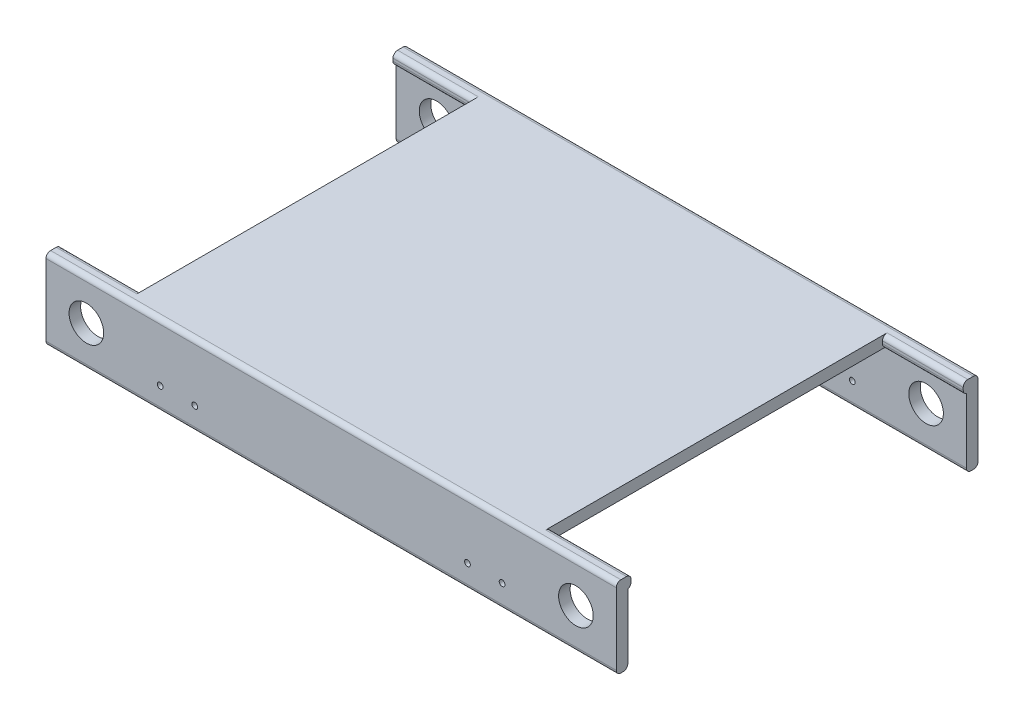
from build123d import *

# Parameters (mm, degrees)
BOSS_EXTRUDE1_DEPTH = 3.175
SKETCH2_W           = 156.972
SKETCH2_H           = 22.225
SKETCH2_R           = 4.7625
SKETCH2_R_2         = 0.79375
BOSS_EXTRUDE2_DEPTH = 3.175
FILLET2_R           = 1.27


with BuildPart() as part:
    # Sketch1 → Boss-Extrude1 (new body)
    with BuildSketch(Plane(origin=(0, 0, 0), x_dir=(1, 0, 0), z_dir=(0, 1, 0))):
        Polygon((-78.486, 49.784), (-78.486, 45.72), (-56.261, 45.72), (-56.261, -45.72), (-78.486, -45.72), (-78.486, -49.784), (78.486, -49.784), (78.486, -45.72), (56.261, -45.72), (56.261, 45.72), (78.486, 45.72), (78.486, 49.784), align=None)
    extrude(amount=BOSS_EXTRUDE1_DEPTH)

    # Sketch2 → Boss-Extrude2 (add)
    with BuildSketch(Plane.XY.offset(49.784)):
        with Locations((0, -7.9375)):
            Rectangle(SKETCH2_W, SKETCH2_H)
        with Locations((-67.3735, -7.9375)):
            Circle(SKETCH2_R, mode=Mode.SUBTRACT)
        with Locations(Location((67.3735, -7.9375, 0), (0, 0, 180))):
            Circle(SKETCH2_R, mode=Mode.SUBTRACT)
        with Locations((-47.0535, -12.7)):
            Circle(SKETCH2_R_2, mode=Mode.SUBTRACT)
        with Locations((-37.5285, -12.7)):
            Circle(SKETCH2_R_2, mode=Mode.SUBTRACT)
        with Locations(Location((37.5285, -12.7, 0), (0, 0, 180))):
            Circle(SKETCH2_R_2, mode=Mode.SUBTRACT)
        with Locations(Location((47.0535, -12.7, 0), (0, 0, 180))):
            Circle(SKETCH2_R_2, mode=Mode.SUBTRACT)
    boss_extrude2 = extrude(amount=-BOSS_EXTRUDE2_DEPTH)

    # Mirror2: Boss-Extrude2 across plane
    add(boss_extrude2.mirror(Plane.XY))

    # Fillet2
    # the kernel refuses this fillet: 1.27 mm, written as the material it takes off along each edge
    with BuildSketch(Plane(origin=(-56.261, 0, 45.72), x_dir=(0, 1, 0), z_dir=(-1, 0, 0)), Plane(origin=(56.261, 0, -45.72), x_dir=(0, 1, 0), z_dir=(1, 0, 0)), Plane(origin=(81.514756964, 0, 45.72), x_dir=(0, 1, 0), z_dir=(-1, 0, 0))) as fillet2_piece_1:
        with BuildLine():
            CenterArc((1.211502786, -1.27), FILLET2_R, 90, 72.542396876)
            Line((0, -0.889), (-0.024230056, -0.88138))
            ThreePointArc((-0.024230056, -0.88138), (-0.0254, -0.4445), (-0.0254, 0))
            Line((-0.0254, 0), (0, 0.0254))
            Line((0, 0.0254), (1.211502786, 0.0254))
            Line((1.211502786, 0.0254), (1.211502786, 0))
        make_face()
    extrude(amount=25.253756964, mode=Mode.SUBTRACT)
    with BuildSketch(Plane(origin=(-81.514756964, 0, -45.72), x_dir=(0, 0, -1), z_dir=(1, 0, 0))) as fillet2_piece_2:
        with BuildLine():
            CenterArc((1.27, 1.211502786), FILLET2_R, 180, 72.542396876)
            Line((0, 1.211502786), (-0.0254, 1.211502786))
            Line((-0.0254, 1.211502786), (-0.0254, 0))
            Line((-0.0254, 0), (0, -0.0254))
            ThreePointArc((0, -0.0254), (0.4445, -0.0254), (0.88138, -0.024230056))
            Line((0.88138, -0.024230056), (0.889, 0))
        make_face()
    extrude(amount=25.253756964, mode=Mode.SUBTRACT)
    with BuildSketch(Plane(origin=(81.661, 3.175, 45.72), x_dir=(0, -1, 0), z_dir=(-1, 0, 0)), Plane(origin=(56.261, 3.175, -45.72), x_dir=(0, -1, 0), z_dir=(1, 0, 0)), Plane(origin=(-81.661, 3.175, -45.72), x_dir=(0, -1, 0), z_dir=(1, 0, 0)), Plane(origin=(-56.261, 3.175, 45.72), x_dir=(0, -1, 0), z_dir=(-1, 0, 0))) as fillet2_piece_3:
        with BuildLine():
            CenterArc((FILLET2_R, FILLET2_R), FILLET2_R, 180, 90)
            Line((0, FILLET2_R), (-FILLET2_R * 0.02, FILLET2_R))
            Line((-FILLET2_R * 0.02, FILLET2_R), (-FILLET2_R * 0.02, -FILLET2_R * 0.02))
            Line((-FILLET2_R * 0.02, -FILLET2_R * 0.02), (FILLET2_R, -FILLET2_R * 0.02))
            Line((FILLET2_R, -FILLET2_R * 0.02), (FILLET2_R, 0))
        make_face()
    extrude(amount=25.4, mode=Mode.SUBTRACT)
    with BuildSketch(Plane(origin=(-81.661, -19.05, -46.609), x_dir=(0, 0, -1), z_dir=(1, 0, 0)), Plane(origin=(-81.661, -19.05, -49.784), x_dir=(0, 1, 0), z_dir=(1, 0, 0)), Plane(origin=(-81.661, 3.175, 49.784), x_dir=(0, -1, 0), z_dir=(1, 0, 0)), Plane(origin=(81.661, 3.175, -49.784), x_dir=(0, -1, 0), z_dir=(-1, 0, 0))) as fillet2_piece_4:
        with BuildLine():
            CenterArc((FILLET2_R, FILLET2_R), FILLET2_R, 180, 90)
            Line((0, FILLET2_R), (-FILLET2_R * 0.02, FILLET2_R))
            Line((-FILLET2_R * 0.02, FILLET2_R), (-FILLET2_R * 0.02, -FILLET2_R * 0.02))
            Line((-FILLET2_R * 0.02, -FILLET2_R * 0.02), (FILLET2_R, -FILLET2_R * 0.02))
            Line((FILLET2_R, -FILLET2_R * 0.02), (FILLET2_R, 0))
        make_face()
    extrude(amount=163.322, mode=Mode.SUBTRACT)
    with BuildSketch(Plane(origin=(-81.661, -19.05, 46.609), x_dir=(0, 0, 1), z_dir=(1, 0, 0)), Plane(origin=(-81.661, -19.05, 49.784), x_dir=(0, 1, 0), z_dir=(1, 0, 0))) as fillet2_piece_5:
        with BuildLine():
            CenterArc((FILLET2_R, -FILLET2_R), FILLET2_R, 90, 90)
            Line((0, -FILLET2_R), (-FILLET2_R * 0.02, -FILLET2_R))
            Line((-FILLET2_R * 0.02, -FILLET2_R), (-FILLET2_R * 0.02, FILLET2_R * 0.02))
            Line((-FILLET2_R * 0.02, FILLET2_R * 0.02), (FILLET2_R, FILLET2_R * 0.02))
            Line((FILLET2_R, FILLET2_R * 0.02), (FILLET2_R, 0))
        make_face()
    extrude(amount=163.322, mode=Mode.SUBTRACT)


solid = part.part
